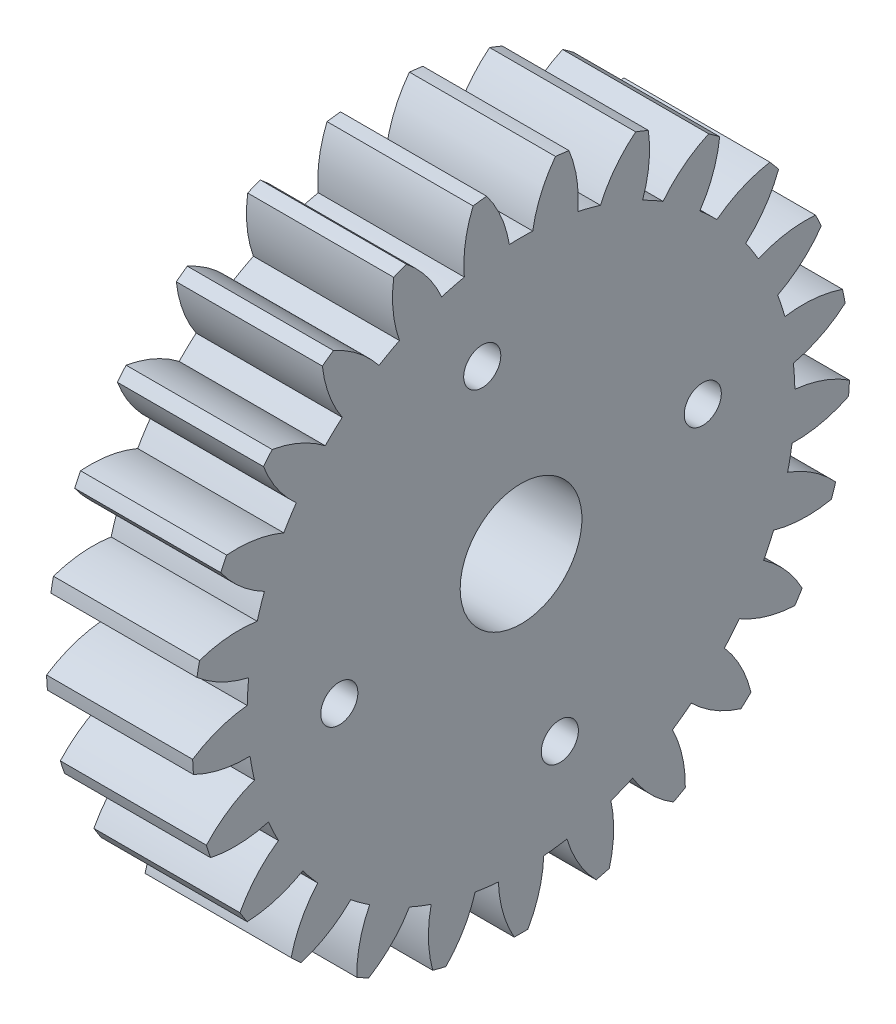
from build123d import *

# Parameters (mm, degrees)
BASPROSKE_W        = 6
BASPROSKE_H        = 13.5
TOOTHCUT_DEPTH     = 21.012496096
TEETHCUTS_COUNT    = 25
TEETHCUTS_ANGLE    = 345.6
BORSKE_R           = 2.5
BORE_DEPTH         = 50.0000508
SKETCH2_R          = 0.762
CUT_EXTRUDE2_DEPTH = 10


with BuildPart() as part:
    # BasProSke → Base-Revolve (revolve)
    with BuildSketch(Plane(origin=(0, 0, 0), x_dir=(1, 0, 0), z_dir=(0, 1, 0))):
        with Locations((3, 6.75)):
            Rectangle(BASPROSKE_W, BASPROSKE_H)
    revolve(axis=Axis((-10, 0, 0), (1, 0, 0)))

    # TooCutSke → ToothCut (cut, through all)
    with BuildSketch(Plane(origin=(0, 0, 0), x_dir=(0, 0, -1), z_dir=(1, 0, 0))):
        with BuildLine():
            ThreePointArc((0.480087995, 11.238750665), (0, 11.249), (-0.480087995, 11.238750665))
            ThreePointArc((-0.480087995, 11.238750665), (-0.821124963, 12.40220054), (-1.432168974, 13.449361962))
            ThreePointArc((-1.432168974, 13.449361962), (0, 13.5254), (1.432168974, 13.449361962))
            ThreePointArc((1.432168974, 13.449361962), (0.821124963, 12.40220054), (0.480087995, 11.238750665))
        make_face()
    toothcut = extrude(amount=TOOTHCUT_DEPTH, mode=Mode.SUBTRACT)

    # TeethCuts: ToothCut ×25 about axis
    teethcuts_axis = Axis((-10, 0, 0), (1, 0, 0))
    for i in range(1, TEETHCUTS_COUNT):
        add(toothcut.rotate(teethcuts_axis, i * TEETHCUTS_ANGLE / (TEETHCUTS_COUNT - 1)), mode=Mode.SUBTRACT)

    # BorSke → Bore (cut, symmetric)
    with BuildSketch(Plane(origin=(0, 0, 0), x_dir=(0, 0, -1), z_dir=(1, 0, 0))):
        Circle(BORSKE_R)
    extrude(amount=BORE_DEPTH, both=True, mode=Mode.SUBTRACT)

    # Sketch2 → Cut-Extrude2 (cut)
    with BuildSketch(Plane(origin=(6, -95.936190115, 88.628294834), x_dir=(0, -0.8234048505569566, -0.5674543612302899), z_dir=(1, 0, 0))):
        with Locations((-25.778113688, 134.466916212)):
            Circle(SKETCH2_R)
        with Locations((-21.651272984, 124.49267918)):
            Circle(SKETCH2_R)
        with Locations((-31.625510016, 120.365838475)):
            Circle(SKETCH2_R)
        with Locations((-35.752350721, 130.340075507)):
            Circle(SKETCH2_R)
    extrude(amount=-CUT_EXTRUDE2_DEPTH, mode=Mode.SUBTRACT)


solid = part.part
